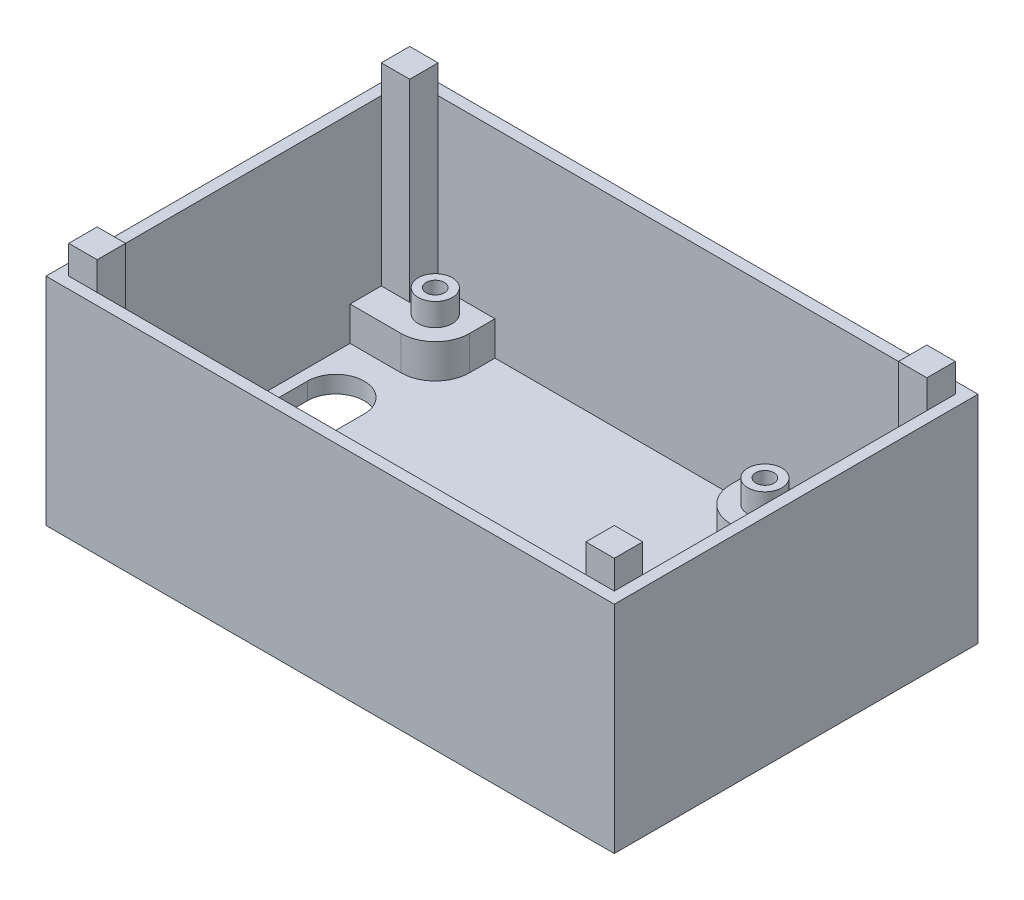
from build123d import *

# Parameters (mm, degrees)
SKETCH1_W                = 100
SKETCH1_H                = 64
BOSS_EXTRUDE1_DEPTH      = 3
SKETCH2_W                = 100
SKETCH2_H                = 64
SKETCH2_W_2              = 96
SKETCH2_H_2              = 60
BOSS_EXTRUDE2_DEPTH      = 35
SKETCH6_R                = 3
SKETCH6_R_2              = 1.6
BOSS_EXTRUDE3_DEPTH      = 10
SKETCH7_R                = 1.5
CUT_EXTRUDE2_DEPTH       = 69.912988616
BOSS_EXTRUDE8_START      = -10
SKETCH10_R               = 3
SKETCH10_W               = 10
SKETCH10_H               = 10.5
SKETCH10_H_2             = 10
BOSS_EXTRUDE8_DEPTH      = 6
SKETCH11_R               = 3
CUT_EXTRUDE4_DEPTH       = 3
BOSS_EXTRUDE9_DEPTH      = 5
BOSS_EXTRUDE9_DEPTH_BACK = 37
SKETCH12_W               = 5
SKETCH12_H               = 5
SKETCH13_W               = 5.5
SKETCH13_H               = 5.5
CUT_EXTRUDE5_DEPTH       = 7
FILLET1_R                = 10


with BuildPart() as part:
    # Sketch1 → Boss-Extrude1 (new body)
    with BuildSketch(Plane(origin=(0, 0, 0), x_dir=(1, 0, 0), z_dir=(0, 1, 0))):
        Rectangle(SKETCH1_W, SKETCH1_H)
    extrude(amount=BOSS_EXTRUDE1_DEPTH)

    # Sketch2 → Boss-Extrude2 (add)
    with BuildSketch(Plane(origin=(0, 3, 0), x_dir=(1, 0, 0), z_dir=(0, 1, 0))):
        Rectangle(SKETCH2_W, SKETCH2_H)
        Rectangle(SKETCH2_W_2, SKETCH2_H_2, mode=Mode.SUBTRACT)
    extrude(amount=BOSS_EXTRUDE2_DEPTH)

    # Sketch6 → Boss-Extrude3 (add)
    # profile 1 of 4: a face of its own
    with BuildSketch(Plane(origin=(0, 3, 0), x_dir=(1, 0, 0), z_dir=(0, 1, 0))):
        with Locations(Location((-39, 25.5, 0), (0, 0, 270))):
            Circle(SKETCH6_R)
        with Locations(Location((-39, 25.5, 0), (0, 0, 270))):
            Circle(SKETCH6_R_2, mode=Mode.SUBTRACT)
    # profile 2 of 4: a face of its own
    with BuildSketch(Plane(origin=(0, 3, 0), x_dir=(1, 0, 0), z_dir=(0, 1, 0))):
        with Locations(Location((19, 25.5, 0), (0, 0, 270))):
            Circle(SKETCH6_R)
        with Locations(Location((19, 25.5, 0), (0, 0, 270))):
            Circle(SKETCH6_R_2, mode=Mode.SUBTRACT)
    # profile 3 of 4: a face of its own
    with BuildSketch(Plane(origin=(0, 3, 0), x_dir=(1, 0, 0), z_dir=(0, 1, 0))):
        with Locations(Location((-39, -23.5, 0), (0, 0, 270))):
            Circle(SKETCH6_R)
        with Locations(Location((-39, -23.5, 0), (0, 0, 270))):
            Circle(SKETCH6_R_2, mode=Mode.SUBTRACT)
    # profile 4 of 4: a face of its own
    with BuildSketch(Plane(origin=(0, 3, 0), x_dir=(1, 0, 0), z_dir=(0, 1, 0))):
        with Locations(Location((19, -23.5, 0), (0, 0, 270))):
            Circle(SKETCH6_R)
        with Locations(Location((19, -23.5, 0), (0, 0, 270))):
            Circle(SKETCH6_R_2, mode=Mode.SUBTRACT)
    extrude(amount=BOSS_EXTRUDE3_DEPTH)

    # Sketch7 → Cut-Extrude2 (cut, through all)
    with BuildSketch(Plane(origin=(0, 3, 0), x_dir=(1, 0, 0), z_dir=(0, 1, 0))):
        with Locations(Location((-39, 25.5, 0), (0, 0, 270))):
            Circle(SKETCH7_R)
        with Locations(Location((19, 25.5, 0), (0, 0, 270))):
            Circle(SKETCH7_R)
        with Locations(Location((19, -23.5, 0), (0, 0, 270))):
            Circle(SKETCH7_R)
        with Locations(Location((-39, -23.5, 0), (0, 0, 270))):
            Circle(SKETCH7_R)
    extrude(amount=-CUT_EXTRUDE2_DEPTH, mode=Mode.SUBTRACT)

    # Sketch10 → Boss-Extrude8 (add)
    # profile 1 of 6: a face of its own
    with BuildSketch(Plane(origin=(0, 13, 0), x_dir=(1, 0, 0), z_dir=(0, 1, 0)).offset(BOSS_EXTRUDE8_START)):
        with BuildLine():
            Line((-33, 25.5), (-33, 30))
            Line((-33, 30), (-48, 30))
            Line((-48, 30), (-48, 19.5))
            Line((-48, 19.5), (-39, 19.5))
            ThreePointArc((-39, 19.5), (-34.757359313, 21.257359313), (-33, 25.5))
        make_face()
        with Locations(Location((-39, 25.5, 0), (0, 0, 270))):
            Circle(SKETCH10_R, mode=Mode.SUBTRACT)
    # profile 2 of 6: a face of its own
    with BuildSketch(Plane(origin=(0, 13, 0), x_dir=(1, 0, 0), z_dir=(0, 1, 0)).offset(BOSS_EXTRUDE8_START)):
        with BuildLine():
            Line((25, 25.5), (25, 30))
            Line((25, 30), (13, 30))
            Line((13, 30), (13, 25.5))
            ThreePointArc((13, 25.5), (19, 19.5), (25, 25.5))
        make_face()
        with Locations(Location((19, 25.5, 0), (0, 0, 270))):
            Circle(SKETCH10_R, mode=Mode.SUBTRACT)
    # profile 3 of 6: a face of its own
    with BuildSketch(Plane(origin=(0, 13, 0), x_dir=(1, 0, 0), z_dir=(0, 1, 0)).offset(BOSS_EXTRUDE8_START)):
        with BuildLine():
            Line((25, -23.5), (25, -30))
            Line((25, -30), (13, -30))
            Line((13, -30), (13, -23.5))
            ThreePointArc((13, -23.5), (19, -17.5), (25, -23.5))
        make_face()
        with Locations(Location((19, -23.5, 0), (0, 0, 270))):
            Circle(SKETCH10_R, mode=Mode.SUBTRACT)
    # profile 4 of 6: a face of its own
    with BuildSketch(Plane(origin=(0, 13, 0), x_dir=(1, 0, 0), z_dir=(0, 1, 0)).offset(BOSS_EXTRUDE8_START)):
        with BuildLine():
            Line((-33, -23.5), (-33, -30))
            Line((-33, -30), (-48, -30))
            Line((-48, -30), (-48, -17.5))
            Line((-48, -17.5), (-39, -17.5))
            ThreePointArc((-39, -17.5), (-34.757359313, -19.257359313), (-33, -23.5))
        make_face()
        with Locations(Location((-39, -23.5, 0), (0, 0, 270))):
            Circle(SKETCH10_R, mode=Mode.SUBTRACT)
    # profile 5 of 6: a face of its own
    with BuildSketch(Plane(origin=(0, 13, 0), x_dir=(1, 0, 0), z_dir=(0, 1, 0)).offset(BOSS_EXTRUDE8_START)):
        with Locations((43, 24.75)):
            Rectangle(SKETCH10_W, SKETCH10_H)
    # profile 6 of 6: a face of its own
    with BuildSketch(Plane(origin=(0, 13, 0), x_dir=(1, 0, 0), z_dir=(0, 1, 0)).offset(BOSS_EXTRUDE8_START)):
        with Locations((43, -25)):
            Rectangle(SKETCH10_W, SKETCH10_H_2)
    extrude(amount=BOSS_EXTRUDE8_DEPTH)

    # Sketch11 → Cut-Extrude4 (cut)
    with BuildSketch(Plane.XZ):
        with Locations(Location((-39, 23.5, 0), (0, 0, 90))):
            Circle(SKETCH11_R)
        with Locations(Location((19, 23.5, 0), (0, 0, 90))):
            Circle(SKETCH11_R)
        with Locations(Location((19, -25.5, 0), (0, 0, 90))):
            Circle(SKETCH11_R)
        with Locations(Location((-39, -25.5, 0), (0, 0, 90))):
            Circle(SKETCH11_R)
        with BuildLine():
            Line((-46, -10), (-46, 10))
            ThreePointArc((-46, 10), (-41, 15), (-36, 10))
            Line((-36, 10), (-36, -10))
            ThreePointArc((-36, -10), (-41, -15), (-46, -10))
        make_face()
    extrude(amount=-CUT_EXTRUDE4_DEPTH, mode=Mode.SUBTRACT)

    # Sketch12 → Boss-Extrude9 (add, two sides: drawn at the far end of the back side and taken through both)
    with BuildSketch(Plane(origin=(0, 38, 0), x_dir=(1, 0, 0), z_dir=(0, 1, 0)).offset(-BOSS_EXTRUDE9_DEPTH_BACK)):
        with Locations((-45.5, 27.5)):
            Rectangle(SKETCH12_W, SKETCH12_H)
        with Locations((45.5, 27.5)):
            Rectangle(SKETCH12_W, SKETCH12_H)
        with Locations((45.5, -27.5)):
            Rectangle(SKETCH12_W, SKETCH12_H)
        with Locations((-45.5, -27.5)):
            Rectangle(SKETCH12_W, SKETCH12_H)
    extrude(amount=BOSS_EXTRUDE9_DEPTH + BOSS_EXTRUDE9_DEPTH_BACK)

    # Sketch13 → Cut-Extrude5 (cut)
    with BuildSketch(Plane.XZ):
        with Locations((-45.25, 27.25)):
            Rectangle(SKETCH13_W, SKETCH13_H)
        with Locations((-45.25, -27.25)):
            Rectangle(SKETCH13_W, SKETCH13_H)
        with Locations((45.25, -27.25)):
            Rectangle(SKETCH13_W, SKETCH13_H)
        with Locations((45.25, 27.25)):
            Rectangle(SKETCH13_W, SKETCH13_H)
    extrude(amount=-CUT_EXTRUDE5_DEPTH, mode=Mode.SUBTRACT)

    # Fillet1
    fillet1_edges = [part.edges().sort_by_distance(p)[0] for p in [
        (38, 6, 20),
        (38, 6, -19.5),
    ]]
    fillet(fillet1_edges, radius=FILLET1_R - 0.0001)  # a hair under: the kernel refuses the full size


solid = part.part
